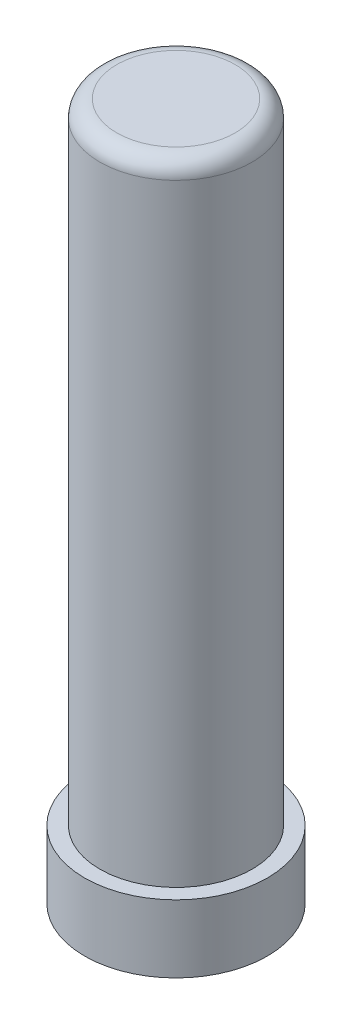
from build123d import *

# Parameters (mm, degrees)
SKETCH1_R           = 2.7
BOSS_EXTRUDE1_DEPTH = 2
SKETCH3_R           = 0.95
CUT_EXTRUDE2_DEPTH  = 9.5
SKETCH2_R           = 2.25
BOSS_EXTRUDE2_DEPTH = 18.6
SKETCH7_R           = 1.2
CUT_EXTRUDE4_DEPTH  = 2.8
FILLET2_R           = 0.5
SKETCH8_R           = 0.95
CUT_EXTRUDE5_DEPTH  = 10.5


with BuildPart() as part:
    # Sketch1 → Boss-Extrude1 (new body)
    with BuildSketch(Plane(origin=(0, 0, 0), x_dir=(1, 0, 0), z_dir=(0, 1, 0))):
        Circle(SKETCH1_R)
    extrude(amount=BOSS_EXTRUDE1_DEPTH)

    # Sketch3 → Cut-Extrude2 (cut)
    with BuildSketch(Plane.XZ):
        Circle(SKETCH3_R)
    extrude(amount=-CUT_EXTRUDE2_DEPTH, mode=Mode.SUBTRACT)

    # Sketch2 → Boss-Extrude2 (add)
    with BuildSketch(Plane(origin=(0, 2, 0), x_dir=(1, 0, 0), z_dir=(0, 1, 0))):
        Circle(SKETCH2_R)
    extrude(amount=BOSS_EXTRUDE2_DEPTH)

    # Sketch7 → Cut-Extrude4 (cut)
    with BuildSketch(Plane.XZ):
        Circle(SKETCH7_R)
    extrude(amount=-CUT_EXTRUDE4_DEPTH, mode=Mode.SUBTRACT)

    # Fillet2
    fillet2_edges = [part.edges().sort_by_distance(p)[0] for p in [
        (-2.25, 20.6, 0),
    ]]
    fillet(fillet2_edges, radius=FILLET2_R)

    # Sketch8 → Cut-Extrude5 (cut)
    with BuildSketch(Plane.XZ):
        Circle(SKETCH8_R)
    extrude(amount=-CUT_EXTRUDE5_DEPTH, mode=Mode.SUBTRACT)


solid = part.part
